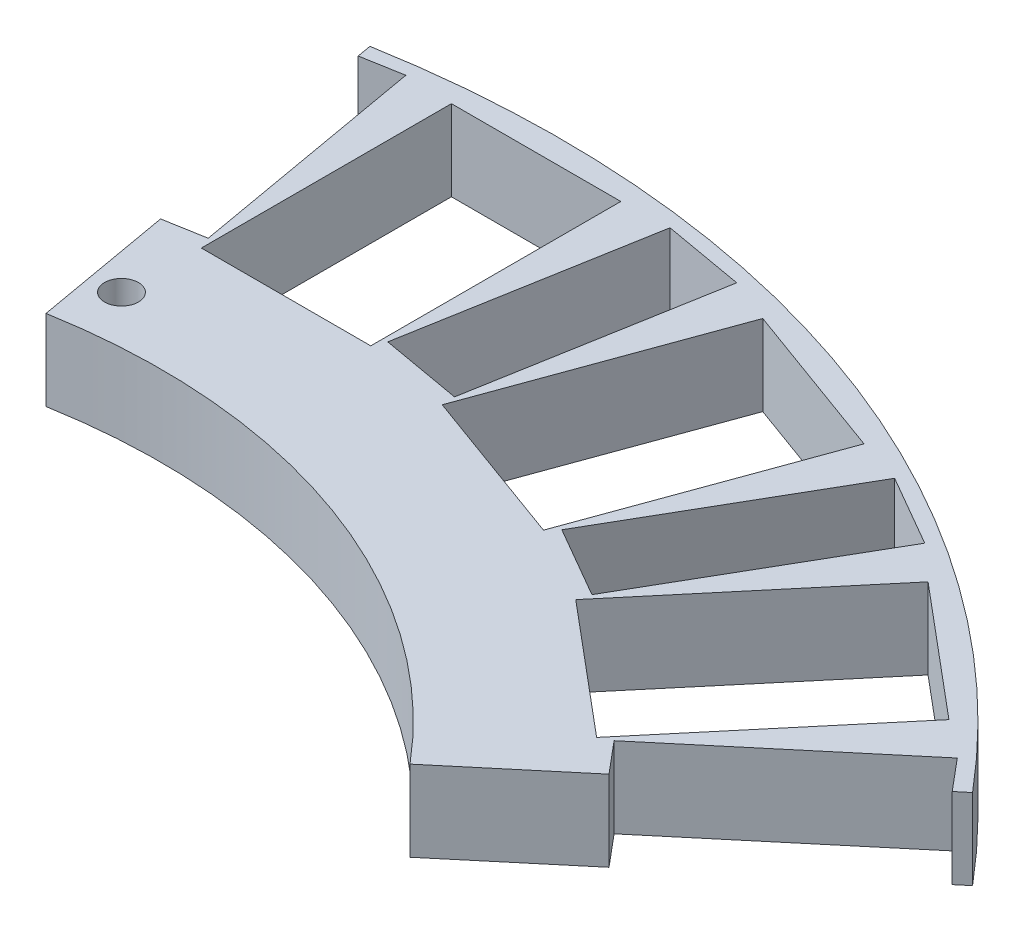
from build123d import *

# Parameters (mm, degrees)
BOSS_EXTRUDE1_START       = -5
BOSS_EXTRUDE1_OUTLINE_R   = 125
BOSS_EXTRUDE1_OUTLINE_R_2 = 2.1
BOSS_EXTRUDE1_OUTLINE_W   = 21
BOSS_EXTRUDE1_OUTLINE_H   = 31
BOSS_EXTRUDE1_OUTLINE_W_2 = 30.2
BOSS_EXTRUDE1_OUTLINE_H_2 = 10.2
BOSS_EXTRUDE1_OUTLINE_R_3 = 75.5
BOSS_EXTRUDE1_DEPTH       = 10
SKETCH4_OUTSIDE_W         = 322.738
SKETCH4_OUTSIDE_H         = 322.738
CUT_EXTRUDE1_DEPTH        = 10


# Read off the part's stored shape, not the designer's step: Boss-Extrude1
with BuildPart() as part:
    # Boss-Extrude1 outline → Boss-Extrude1 (new body)
    with BuildSketch(Plane(origin=(0, 0, 0), x_dir=(1, 0, 0), z_dir=(0, 1, 0)).offset(BOSS_EXTRUDE1_START)):
        Circle(BOSS_EXTRUDE1_OUTLINE_R)
        Polygon((-86.463555034, -86.708152159), (-66.537139134, -62.960774422), (-50.450205829, -76.459314226), (-70.376621729, -100.206691962), align=None, mode=Mode.SUBTRACT)
        Polygon((-91.105361481, -83.104052392), (-97.661795099, -75.290399072), (-74.527252917, -55.87821326), (-67.970819298, -63.69186658), align=None, mode=Mode.SUBTRACT)
        Polygon((-51.593230004, -111.051288231), (-40.990605561, -81.920816987), (-21.257060524, -89.103239996), (-31.859684967, -118.233711241), align=None, mode=Mode.SUBTRACT)
        Polygon((-16.372500708, -122.222795071), (-26.417539789, -120.451583659), (-21.173364823, -90.710389518), (-11.128325743, -92.48160093), align=None, mode=Mode.SUBTRACT)
        Polygon((-57.187775987, -109.252133582), (-66.021235106, -104.152133582), (-50.921235106, -77.998166387), (-42.087775987, -83.098166387), align=None, mode=Mode.SUBTRACT)
        Polygon((-114.034295807, -46.932395999), (-117.522901269, -37.347531267), (-89.144184122, -27.018522939), (-85.65557866, -36.603387671), align=None, mode=Mode.SUBTRACT)
        Polygon((-110.905099262, -51.90673326), (-84.058311744, -36.40673326), (-73.558311744, -54.59326674), (-100.405099262, -70.09326674), align=None, mode=Mode.SUBTRACT)
        Polygon((-121.969851733, -10.844596269), (-91.44081139, -5.461502761), (-87.794199659, -26.142465574), (-118.323240002, -31.525559082), align=None, mode=Mode.SUBTRACT)
        with Locations((-81.298478633, -10.703147762)):
            Circle(BOSS_EXTRUDE1_OUTLINE_R_2, mode=Mode.SUBTRACT)
        with Locations((0, -106.5)):
            Rectangle(BOSS_EXTRUDE1_OUTLINE_W, BOSS_EXTRUDE1_OUTLINE_H, mode=Mode.SUBTRACT)
        Polygon((26.417539789, -120.451583659), (16.372500708, -122.222795071), (11.128325743, -92.48160093), (21.173364823, -90.710389518), align=None, mode=Mode.SUBTRACT)
        Polygon((31.859684968, -118.233711241), (21.257060524, -89.103239996), (40.990605561, -81.920816987), (51.593230004, -111.051288231), align=None, mode=Mode.SUBTRACT)
        with Locations((10.703147762, -81.298478633)):
            Circle(BOSS_EXTRUDE1_OUTLINE_R_2, mode=Mode.SUBTRACT)
        Polygon((66.021235106, -104.152133582), (57.187775987, -109.252133582), (42.087775987, -83.098166387), (50.921235106, -77.998166387), align=None, mode=Mode.SUBTRACT)
        Polygon((70.376621729, -100.206691962), (50.450205829, -76.459314226), (66.537139134, -62.960774422), (86.463555035, -86.708152159), align=None, mode=Mode.SUBTRACT)
        Polygon((97.661795099, -75.290399072), (91.105361481, -83.104052392), (67.970819298, -63.69186658), (74.527252917, -55.87821326), align=None, mode=Mode.SUBTRACT)
        Polygon((100.405099262, -70.09326674), (73.558311744, -54.59326674), (84.058311744, -36.40673326), (110.905099262, -51.90673326), align=None, mode=Mode.SUBTRACT)
        Polygon((117.522901269, -37.347531267), (114.034295807, -46.932395999), (85.65557866, -36.603387671), (89.144184122, -27.018522939), align=None, mode=Mode.SUBTRACT)
        Polygon((118.323240002, -31.525559082), (87.794199659, -26.142465574), (91.44081139, -5.461502761), (121.969851733, -10.844596269), align=None, mode=Mode.SUBTRACT)
        with Locations((-108.109011093, 0)):
            Rectangle(BOSS_EXTRUDE1_OUTLINE_W_2, BOSS_EXTRUDE1_OUTLINE_H_2, mode=Mode.SUBTRACT)
        Polygon((-118.323240002, 31.525559082), (-87.794199659, 26.142465574), (-91.44081139, 5.461502761), (-121.969851733, 10.844596269), align=None, mode=Mode.SUBTRACT)
        Polygon((-117.522901269, 37.347531267), (-114.034295807, 46.932395999), (-85.65557866, 36.603387671), (-89.144184122, 27.018522939), align=None, mode=Mode.SUBTRACT)
        Polygon((-100.405099262, 70.09326674), (-73.558311744, 54.59326674), (-84.058311744, 36.40673326), (-110.905099262, 51.90673326), align=None, mode=Mode.SUBTRACT)
        Polygon((-97.661795099, 75.290399072), (-91.105361481, 83.104052392), (-67.970819298, 63.69186658), (-74.527252917, 55.87821326), align=None, mode=Mode.SUBTRACT)
        Polygon((-70.376621729, 100.206691962), (-50.450205829, 76.459314226), (-66.537139134, 62.960774422), (-86.463555035, 86.708152159), align=None, mode=Mode.SUBTRACT)
        Polygon((-66.021235106, 104.152133582), (-57.187775987, 109.252133582), (-42.087775987, 83.098166387), (-50.921235106, 77.998166387), align=None, mode=Mode.SUBTRACT)
        with Locations((-10.703147762, 81.298478633)):
            Circle(BOSS_EXTRUDE1_OUTLINE_R_2, mode=Mode.SUBTRACT)
        Polygon((-31.859684967, 118.233711241), (-21.257060524, 89.103239996), (-40.990605561, 81.920816987), (-51.593230004, 111.051288231), align=None, mode=Mode.SUBTRACT)
        Polygon((-26.417539789, 120.451583659), (-16.372500708, 122.222795071), (-11.128325743, 92.48160093), (-21.173364823, 90.710389518), align=None, mode=Mode.SUBTRACT)
        Circle(BOSS_EXTRUDE1_OUTLINE_R_3, mode=Mode.SUBTRACT)
        with Locations((81.298478633, 10.703147762)):
            Circle(BOSS_EXTRUDE1_OUTLINE_R_2, mode=Mode.SUBTRACT)
        with Locations((108.109011093, 0)):
            Rectangle(BOSS_EXTRUDE1_OUTLINE_W_2, BOSS_EXTRUDE1_OUTLINE_H_2, mode=Mode.SUBTRACT)
        Polygon((121.969851733, 10.844596269), (91.44081139, 5.461502761), (87.794199659, 26.142465574), (118.323240002, 31.525559082), align=None, mode=Mode.SUBTRACT)
        Polygon((110.905099262, 51.90673326), (84.058311744, 36.40673326), (73.558311744, 54.59326674), (100.405099262, 70.09326674), align=None, mode=Mode.SUBTRACT)
        Polygon((114.034295807, 46.932395999), (117.522901269, 37.347531267), (89.144184122, 27.018522939), (85.65557866, 36.603387671), align=None, mode=Mode.SUBTRACT)
        Polygon((57.187775987, 109.252133582), (66.021235106, 104.152133582), (50.921235106, 77.998166387), (42.087775987, 83.098166387), align=None, mode=Mode.SUBTRACT)
        with Locations((0, 106.5)):
            Rectangle(BOSS_EXTRUDE1_OUTLINE_W, BOSS_EXTRUDE1_OUTLINE_H, mode=Mode.SUBTRACT)
        Polygon((16.372500708, 122.222795071), (26.417539789, 120.451583659), (21.173364823, 90.710389518), (11.128325743, 92.48160093), align=None, mode=Mode.SUBTRACT)
        Polygon((51.593230004, 111.051288231), (40.990605561, 81.920816987), (21.257060524, 89.103239996), (31.859684967, 118.233711241), align=None, mode=Mode.SUBTRACT)
        Polygon((91.105361481, 83.104052392), (97.661795099, 75.290399072), (74.527252917, 55.87821326), (67.970819298, 63.69186658), align=None, mode=Mode.SUBTRACT)
        Polygon((86.463555035, 86.708152159), (66.537139134, 62.960774422), (50.450205829, 76.459314226), (70.376621729, 100.206691962), align=None, mode=Mode.SUBTRACT)
    extrude(amount=BOSS_EXTRUDE1_DEPTH)

    # Sketch4 outside → Cut-Extrude1 (cut)
    with BuildSketch(Plane(origin=(0, 5, 0), x_dir=(1, 0, 0), z_dir=(0, 1, 0))):
        Rectangle(SKETCH4_OUTSIDE_W, SKETCH4_OUTSIDE_H)
        with BuildLine():
            Line((-10.697510124, 60.668594683), (-21.395020248, 121.337189365))
            Line((-21.395020248, 121.337189365), (-23.360523909, 132.484114544))
            ThreePointArc((-23.360523909, 132.484114544), (45.824573947, 126.527015659), (101.778053823, 85.401927425))
            Line((101.778053823, 85.401927425), (94.38357829, 79.197225732))
            Line((94.38357829, 79.197225732), (51.307753621, 43.05231714))
            ThreePointArc((51.307753621, 43.05231714), (21.817456639, 57.183528482), (-10.697510124, 60.668594683))
        make_face(mode=Mode.SUBTRACT)
    extrude(amount=-CUT_EXTRUDE1_DEPTH, mode=Mode.SUBTRACT)


solid = part.part
